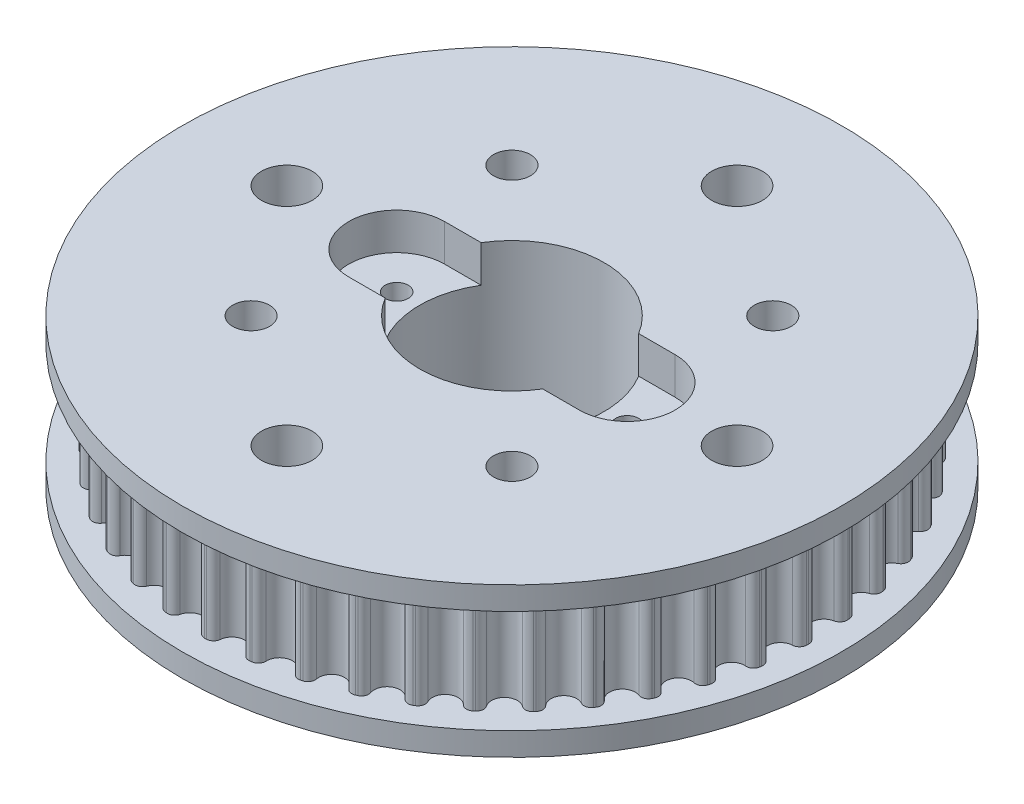
from build123d import *
from build123d.topology import SkipClean

# Parameters (mm, degrees)
BOSS_EXTRUDE1_DEPTH     = 3.556
CIRPATTERN1_COUNT       = 45
SKETCH2_W               = 16.342208267
SKETCH2_H               = 1.5875
CUT_EXTRUDE1_DEPTH      = 34.249871163
CUT_EXTRUDE1_DEPTH_BACK = 34.249871163
SKETCH3_R               = 1.74625
SKETCH3_R_2             = 6.35
SKETCH3_R_3             = 1.27
CUT_EXTRUDE2_DEPTH      = 2.54
SKETCH5_R               = 0.79375
CUT_EXTRUDE3_DEPTH      = 34.013461513


with BuildPart() as part:
    # Sketch1 → Boss-Extrude1 (new, symmetric)
    with BuildSketch(Plane(origin=(0, 0, 0), x_dir=(1, 0, 0), z_dir=(0, 1, 0))):
        with BuildLine():
            ThreePointArc((0, 19.884811005), (0.578412474, 20.098394706), (0.879208145, 20.636633455))
            ThreePointArc((0.879208145, 20.636633455), (1.061044452, 20.949637237), (1.406466311, 21.057894109))
            ThreePointArc((1.406466311, 21.057894109), (1.472197202, 21.053400846), (1.537913746, 21.048702409))
            ThreePointArc((1.537913746, 21.048702409), (1.864907538, 20.893425655), (2.00141252, 20.558161281))
            ThreePointArc((2.00141252, 20.558161281), (2.224372512, 19.983297968), (2.76743081, 19.691293391))
            ThreePointArc((2.76743081, 19.691293391), (-1.387094297, -19.836372605), (0, 19.884811005))
        make_face()
    boss_extrude1 = extrude(amount=BOSS_EXTRUDE1_DEPTH, both=True)

    # CirPattern1: Boss-Extrude1 ×45 about axis
    cirpattern1_axis = Axis((0, 3.3, 0), (0, -1, 0))
    for i in range(1, CIRPATTERN1_COUNT):
        add(boss_extrude1.rotate(cirpattern1_axis, i * 360 / CIRPATTERN1_COUNT))

    # Sketch2 → Revolve3 (revolve)
    with BuildSketch(Plane(origin=(0, 0, 0), x_dir=(0, 0, -1), z_dir=(1, 0, 0))):
        with Locations((14.521104134, 4.34975)):
            Rectangle(SKETCH2_W, SKETCH2_H)
    revolve3 = revolve(axis=Axis((0, 3.3, 0), (0, -1, 0)))

    # Mirror1: Revolve3 across plane
    add(revolve3.mirror(Plane.ZX))

    # Sketch3 → Cut-Extrude1 (cut, two sides: drawn at the far end of the back side and taken through both)
    with SkipClean():  # the faces are left unmerged after this step: merging them gives an invalid solid
        with BuildSketch(Plane(origin=(0, 3.556, 0), x_dir=(1, 0, 0), z_dir=(0, 1, 0)).offset(-CUT_EXTRUDE1_DEPTH_BACK)):
            with Locations((-15.5, 0)):
                Circle(SKETCH3_R)
            Circle(SKETCH3_R_2)
            with Locations((0, 15.5)):
                Circle(SKETCH3_R)
            with Locations((15.5, 0)):
                Circle(SKETCH3_R)
            with Locations((0, -15.5)):
                Circle(SKETCH3_R)
            with Locations((-8.980256121, 8.980256121)):
                Circle(SKETCH3_R_3)
            with Locations((8.980256121, 8.980256121)):
                Circle(SKETCH3_R_3)
            with Locations((8.980256121, -8.980256121)):
                Circle(SKETCH3_R_3)
            with Locations((-8.980256121, -8.980256121)):
                Circle(SKETCH3_R_3)
        extrude(amount=CUT_EXTRUDE1_DEPTH + CUT_EXTRUDE1_DEPTH_BACK, mode=Mode.SUBTRACT)

    # Sketch4 → Cut-Extrude2 (cut)
    with SkipClean():  # the faces are left unmerged after this step: merging them gives an invalid solid
        with BuildSketch(Plane(origin=(0, 5.1435, 0), x_dir=(1, 0, 0), z_dir=(0, 1, 0))):
            with BuildLine():
                Line((-7.9375, 3.302), (7.9375, 3.302))
                ThreePointArc((7.9375, 3.302), (11.2395, 0), (7.9375, -3.302))
                Line((7.9375, -3.302), (-7.9375, -3.302))
                ThreePointArc((-7.9375, -3.302), (-11.2395, 0), (-7.9375, 3.302))
            make_face()
        extrude(amount=-CUT_EXTRUDE2_DEPTH, mode=Mode.SUBTRACT)

    # Sketch5 → Cut-Extrude3 (cut, through all)
    with SkipClean():  # the faces are left unmerged after this step: merging them gives an invalid solid
        with BuildSketch(Plane(origin=(0, 2.6035, 0), x_dir=(1, 0, 0), z_dir=(0, 1, 0))):
            with Locations((-7.9375, 0)):
                Circle(SKETCH5_R)
            with Locations((7.9375, 0)):
                Circle(SKETCH5_R)
        extrude(amount=-CUT_EXTRUDE3_DEPTH, mode=Mode.SUBTRACT)


solid = part.part
